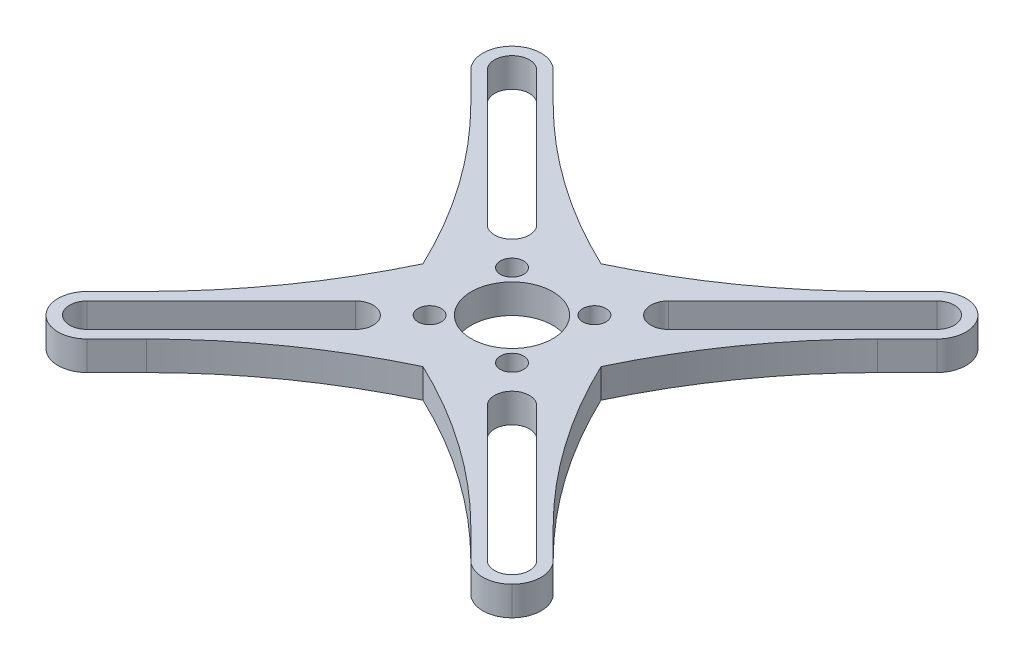
from build123d import *

# Parameters (mm, degrees)
SKETCH1_R           = 14
SKETCH1_R_2         = 2
SKETCH1_R_3         = 7
BOSS_EXTRUDE1_DEPTH = 5
BOSS_EXTRUDE3_START = -5
BOSS_EXTRUDE3_DEPTH = 5
FILLET1_R           = 5
FILLET2_R           = 100


# Some blends are built 0.0001 mm under size
with BuildPart() as part:
    # Sketch1 → Boss-Extrude1 (new body)
    with BuildSketch(Plane(origin=(0, 0, 0), x_dir=(1, 0, 0), z_dir=(0, 1, 0))):
        with Locations(Location((0, 0, 0), (0, 0, 270))):
            Circle(SKETCH1_R)
        with Locations(Location((7.071067812, 7.071067812, 0), (0, 0, 270))):
            Circle(SKETCH1_R_2, mode=Mode.SUBTRACT)
        with Locations(Location((7.071067812, -7.071067812, 0), (0, 0, 270))):
            Circle(SKETCH1_R_2, mode=Mode.SUBTRACT)
        with Locations(Location((-7.071067812, -7.071067812, 0), (0, 0, 270))):
            Circle(SKETCH1_R_2, mode=Mode.SUBTRACT)
        with Locations(Location((-7.071067812, 7.071067812, 0), (0, 0, 270))):
            Circle(SKETCH1_R_2, mode=Mode.SUBTRACT)
        with Locations(Location((0, 0, 0), (0, 0, 270))):
            Circle(SKETCH1_R_3, mode=Mode.SUBTRACT)
    extrude(amount=BOSS_EXTRUDE1_DEPTH)

    # Sketch4 → Boss-Extrude3 (add)
    # profile 1 of 7: a face of its own
    with BuildSketch(Plane(origin=(0, 5, 0), x_dir=(1, 0, 0), z_dir=(0, 1, 0)).offset(BOSS_EXTRUDE3_START)):
        with BuildLine():
            ThreePointArc((-5.711087099, -12.78215491), (-7.937253933, -11.532562595), (-9.899494937, -9.899494937))
            ThreePointArc((-9.899494937, -9.899494937), (-11.532562595, -7.937253933), (-12.78215491, -5.711087099))
            Line((-12.78215491, -5.711087099), (-43.535533906, -36.464466094))
            Line((-43.535533906, -36.464466094), (-36.464466094, -43.535533906))
            Line((-36.464466094, -43.535533906), (-5.711087099, -12.78215491))
        make_face()
        with BuildLine():
            ThreePointArc((-15.541841567, -11.29920088), (-11.29920088, -11.29920088), (-11.29920088, -15.541841567))
            Line((-11.29920088, -15.541841567), (-34.343145751, -38.585786438))
            ThreePointArc((-34.343145751, -38.585786438), (-38.585786438, -38.585786438), (-38.585786438, -34.343145751))
            Line((-38.585786438, -34.343145751), (-15.541841567, -11.29920088))
        make_face(mode=Mode.SUBTRACT)
    # profile 2 of 7: a face of its own
    with BuildSketch(Plane(origin=(0, 5, 0), x_dir=(1, 0, 0), z_dir=(0, 1, 0)).offset(BOSS_EXTRUDE3_START)):
        with BuildLine():
            ThreePointArc((-10.420735139, 9.349239497), (-10.163839474, 9.627895261), (-9.899494937, 9.899494937))
            Line((-9.899494937, 9.899494937), (-11.29920088, 11.29920088))
            ThreePointArc((-11.29920088, 11.29920088), (-13.420521224, 10.420521224), (-15.541841567, 11.29920088))
            Line((-15.541841567, 11.29920088), (-38.585786438, 34.343145751))
            ThreePointArc((-38.585786438, 34.343145751), (-39.464466094, 36.464466094), (-38.585786438, 38.585786438))
            Line((-38.585786438, 38.585786438), (-40, 40))
            Line((-40, 40), (-43.535533906, 36.464466094))
            Line((-43.535533906, 36.464466094), (-13.420521224, 6.349453412))
            Line((-13.420521224, 6.349453412), (-10.420735139, 9.349239497))
        make_face()
    # profile 3 of 7: a face of its own
    with BuildSketch(Plane(origin=(0, 5, 0), x_dir=(1, 0, 0), z_dir=(0, 1, 0)).offset(BOSS_EXTRUDE3_START)):
        with BuildLine():
            ThreePointArc((-12.78215491, 5.711087099), (-11.743192278, 7.622167351), (-10.420735139, 9.349239497))
            Line((-10.420735139, 9.349239497), (-13.420521224, 6.349453412))
            Line((-13.420521224, 6.349453412), (-12.78215491, 5.711087099))
        make_face()
    # profile 4 of 7: a face of its own
    with BuildSketch(Plane(origin=(0, 5, 0), x_dir=(1, 0, 0), z_dir=(0, 1, 0)).offset(BOSS_EXTRUDE3_START)):
        with BuildLine():
            Line((-11.29920088, 11.29920088), (-9.899494937, 9.899494937))
            ThreePointArc((-9.899494937, 9.899494937), (-9.627895261, 10.163839474), (-9.349239497, 10.420735139))
            Line((-9.349239497, 10.420735139), (-6.349453412, 13.420521224))
            Line((-6.349453412, 13.420521224), (-36.464466094, 43.535533906))
            Line((-36.464466094, 43.535533906), (-40, 40))
            Line((-40, 40), (-38.585786438, 38.585786438))
            ThreePointArc((-38.585786438, 38.585786438), (-36.464466094, 39.464466094), (-34.343145751, 38.585786438))
            Line((-34.343145751, 38.585786438), (-11.29920088, 15.541841567))
            ThreePointArc((-11.29920088, 15.541841567), (-10.420521224, 13.420521224), (-11.29920088, 11.29920088))
        make_face()
    # profile 5 of 7: a face of its own
    with BuildSketch(Plane(origin=(0, 5, 0), x_dir=(1, 0, 0), z_dir=(0, 1, 0)).offset(BOSS_EXTRUDE3_START)):
        with BuildLine():
            Line((-6.349453412, 13.420521224), (-9.349239497, 10.420735139))
            ThreePointArc((-9.349239497, 10.420735139), (-7.622167351, 11.743192278), (-5.711087099, 12.78215491))
            Line((-5.711087099, 12.78215491), (-6.349453412, 13.420521224))
        make_face()
    # profile 6 of 7: a face of its own
    with BuildSketch(Plane(origin=(0, 5, 0), x_dir=(1, 0, 0), z_dir=(0, 1, 0)).offset(BOSS_EXTRUDE3_START)):
        with BuildLine():
            ThreePointArc((5.711087099, 12.78215491), (7.937253933, 11.532562595), (9.899494937, 9.899494937))
            ThreePointArc((9.899494937, 9.899494937), (11.532562595, 7.937253933), (12.78215491, 5.711087099))
            Line((12.78215491, 5.711087099), (43.535533906, 36.464466094))
            Line((43.535533906, 36.464466094), (36.464466094, 43.535533906))
            Line((36.464466094, 43.535533906), (5.711087099, 12.78215491))
        make_face()
        with BuildLine():
            ThreePointArc((15.541841567, 11.29920088), (11.29920088, 11.29920088), (11.29920088, 15.541841567))
            Line((11.29920088, 15.541841567), (34.343145751, 38.585786438))
            ThreePointArc((34.343145751, 38.585786438), (38.585786438, 38.585786438), (38.585786438, 34.343145751))
            Line((38.585786438, 34.343145751), (15.541841567, 11.29920088))
        make_face(mode=Mode.SUBTRACT)
    # profile 7 of 7: a face of its own
    with BuildSketch(Plane(origin=(0, 5, 0), x_dir=(1, 0, 0), z_dir=(0, 1, 0)).offset(BOSS_EXTRUDE3_START)):
        with BuildLine():
            ThreePointArc((12.78215491, -5.711087099), (11.532562595, -7.937253933), (9.899494937, -9.899494937))
            ThreePointArc((9.899494937, -9.899494937), (7.937253933, -11.532562595), (5.711087099, -12.78215491))
            Line((5.711087099, -12.78215491), (36.464466094, -43.535533906))
            Line((36.464466094, -43.535533906), (43.535533906, -36.464466094))
            Line((43.535533906, -36.464466094), (12.78215491, -5.711087099))
        make_face()
        with BuildLine():
            ThreePointArc((11.29920088, -15.541841567), (11.29920088, -11.29920088), (15.541841567, -11.29920088))
            Line((15.541841567, -11.29920088), (38.585786438, -34.343145751))
            ThreePointArc((38.585786438, -34.343145751), (38.585786438, -38.585786438), (34.343145751, -38.585786438))
            Line((34.343145751, -38.585786438), (11.29920088, -15.541841567))
        make_face(mode=Mode.SUBTRACT)
    extrude(amount=BOSS_EXTRUDE3_DEPTH)

    # Fillet1
    fillet1_edges = [part.edges().sort_by_distance(p)[0] for p in [
        (-36.464466094, 2.5, 43.535533906),
        (-43.535533906, 2.5, 36.464466094),
        (-43.535533906, 2.5, -36.464466094),
        (-36.464466094, 2.5, -43.535533906),
        (36.464466094, 2.5, -43.535533906),
        (43.535533906, 2.5, -36.464466094),
        (36.464466094, 2.5, 43.535533906),
        (43.535533906, 2.5, 36.464466094),
    ]]
    fillet(fillet1_edges, radius=FILLET1_R - 0.0001)  # a hair under: the kernel refuses the full size

    # Fillet2
    # the kernel refuses this fillet: 100 mm, written as the material it adds along each edge
    with BuildSketch(Plane(origin=(-5.711087099, 0, 12.78215491), x_dir=(0.9998484998051017, 0, 0.017406247082228966), z_dir=(0, 1, 0)), Plane(origin=(-12.78215491, 0, -5.711087099), x_dir=(-0.017406247082221098, 0, 0.9998484998051018), z_dir=(0, 1, 0))) as fillet2_piece_1:
        with BuildLine():
            CenterArc((50.173554479, -91.997335747), FILLET2_R, 113.07781271, 22.919542152)
            Line((-21.757218493, -22.528177844), (0, 0))
            ThreePointArc((0, 0), (5.487732521, -1.120372995), (10.975465042, 0))
        make_face()
    extrude(amount=5)
    with BuildSketch(Plane(origin=(5.711087099, 0, 12.78215491), x_dir=(0.7071067811865421, 0, 0.7071067811865529), z_dir=(0, 1, 0)), Plane(origin=(-12.78215491, 0, 5.711087099), x_dir=(-0.7071067811865551, 0, 0.7071067811865399), z_dir=(0, 1, 0))) as fillet2_piece_2:
        with BuildLine():
            CenterArc((31.31924893, -100), FILLET2_R, 90, 22.919542152)
            ThreePointArc((-7.624563141, -7.894736842), (-3.006388615, -4.725682106), (0, 0))
            Line((0, 0), (31.31924893, 0))
        make_face()
    extrude(amount=5)
    with BuildSketch(Plane(origin=(12.78215491, 0, 5.711087099), x_dir=(0.7071067811865436, 0, 0.7071067811865516), z_dir=(0, 1, 0)), Plane(origin=(5.711087099, 0, -12.78215491), x_dir=(0.7071067811865498, 0, -0.7071067811865454), z_dir=(0, 1, 0))) as fillet2_piece_3:
        with BuildLine():
            CenterArc((31.31924893, 100), FILLET2_R, 247.080457848, 22.919542152)
            ThreePointArc((-7.624563141, 7.894736842), (-3.006388615, 4.725682106), (0, 0))
            Line((0, 0), (31.31924893, 0))
        make_face()
    extrude(amount=5)
    with BuildSketch(Plane(origin=(12.78215491, 0, -5.711087099), x_dir=(0.01740624708221406, 0, 0.9998484998051019), z_dir=(0, 1, 0)), Plane(origin=(-5.711087099, 0, -12.78215491), x_dir=(0.9998484998051018, 0, -0.017406247082221094), z_dir=(0, 1, 0))) as fillet2_piece_4:
        with BuildLine():
            CenterArc((50.173554479, 91.997335747), FILLET2_R, 224.002645138, 22.919542152)
            Line((-21.757218493, 22.528177844), (0, 0))
            ThreePointArc((0, 0), (5.487732521, 1.120372995), (10.975465042, 0))
        make_face()
    extrude(amount=5)


solid = part.part
